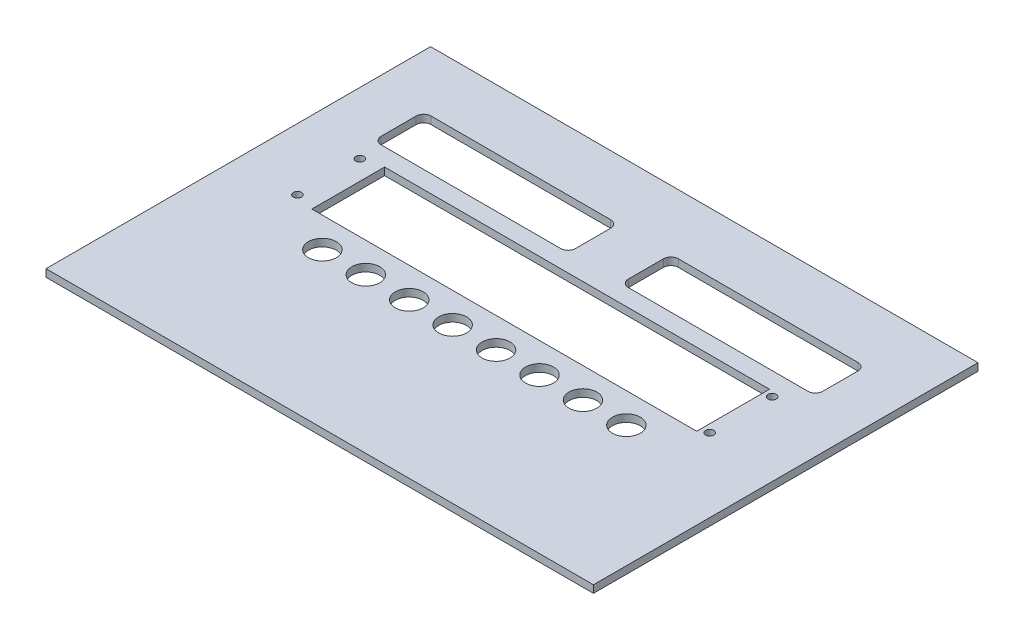
from build123d import *

# Parameters (mm, degrees)
SKETCH1_W                = 232.41
SKETCH1_H                = 163.2712
BOSS_EXTRUDE1_DEPTH      = 3.175
SKETCH2_W                = 82.55
SKETCH2_H                = 21.209
CUT_EXTRUDE1_DEPTH       = 143.049476723
FILLET1_R                = 3.175
LPATTERN1_COUNT          = 2
LPATTERN1_PITCH          = 104.9866582
FILLET1_OF_LPATTERN1_R   = 3.175
CUT_EXTRUDE4_START       = -3.175
CUT_EXTRUDE4_OUTLINE_R   = 5.92074
CUT_EXTRUDE4_OUTLINE_W   = 163.40074
CUT_EXTRUDE4_OUTLINE_H   = 30.8991
CUT_EXTRUDE4_OUTLINE_R_2 = 1.75
CUT_EXTRUDE4_DEPTH       = 3.175


# Read off the part's stored shape, not the designer's step: Cut-Extrude4
with BuildPart() as part:
    # Sketch1 → Boss-Extrude1 (new body)
    with BuildSketch(Plane(origin=(0, 0, 0), x_dir=(1, 0, 0), z_dir=(0, 1, 0))):
        Rectangle(SKETCH1_W, SKETCH1_H)
    extrude(amount=-BOSS_EXTRUDE1_DEPTH)

    # Sketch2 → Cut-Extrude1 (cut, through all)
    with BuildSketch(Plane(origin=(0, 0, 0), x_dir=(1, 0, 0), z_dir=(0, 1, 0))):
        with Locations((-52.49333418, 45.6311)):
            Rectangle(SKETCH2_W, SKETCH2_H)
    cut_extrude1 = extrude(amount=-CUT_EXTRUDE1_DEPTH, mode=Mode.SUBTRACT)

    # Fillet1
    fillet1_edges = [part.edges().sort_by_distance(p)[0] for p in [
        (-93.76833418, -1.5875, -35.0266),
        (-93.76833418, -1.5875, -56.2356),
        (-11.21833418, -1.5875, -56.2356),
        (-11.21833418, -1.5875, -35.0266),
    ]]
    fillet(fillet1_edges, radius=FILLET1_R)

    # LPattern1: Cut-Extrude1 ×2
    with Locations(*[(i * LPATTERN1_PITCH, 0, 0) for i in range(1, LPATTERN1_COUNT)]):
        add(cut_extrude1, mode=Mode.SUBTRACT)

    # Fillet1 of LPattern1
    fillet1_of_lpattern1_edges = [part.edges().sort_by_distance(p)[0] for p in [
        (11.21832402, -1.5875, -35.0266),
        (11.21832402, -1.5875, -56.2356),
        (93.76832402, -1.5875, -56.2356),
        (93.76832402, -1.5875, -35.0266),
    ]]
    fillet(fillet1_of_lpattern1_edges, radius=FILLET1_OF_LPATTERN1_R)

    # Cut-Extrude4 outline → Cut-Extrude4 (cut)
    with BuildSketch(Plane(origin=(0, 0, 0), x_dir=(1, 0, 0), z_dir=(0, 1, 0)).offset(CUT_EXTRUDE4_START)):
        with Locations((-64.529208, -15.98168)):
            Circle(CUT_EXTRUDE4_OUTLINE_R)
        with Locations((-46.091348, -15.98168)):
            Circle(CUT_EXTRUDE4_OUTLINE_R)
        with Locations((-27.653488, -15.98168)):
            Circle(CUT_EXTRUDE4_OUTLINE_R)
        with Locations((-9.215628, -15.98168)):
            Circle(CUT_EXTRUDE4_OUTLINE_R)
        with Locations((9.222232, -15.98168)):
            Circle(CUT_EXTRUDE4_OUTLINE_R)
        with Locations((27.660092, -15.98168)):
            Circle(CUT_EXTRUDE4_OUTLINE_R)
        with Locations((46.097952, -15.98168)):
            Circle(CUT_EXTRUDE4_OUTLINE_R)
        with Locations((64.535812, -15.98168)):
            Circle(CUT_EXTRUDE4_OUTLINE_R)
        with Locations((0, 12.16787)):
            Rectangle(CUT_EXTRUDE4_OUTLINE_W, CUT_EXTRUDE4_OUTLINE_H)
        with Locations((-90, 25.41778)):
            Circle(CUT_EXTRUDE4_OUTLINE_R_2)
        with Locations((-90, -1.08222)):
            Circle(CUT_EXTRUDE4_OUTLINE_R_2)
        with Locations((85, -1.08222)):
            Circle(CUT_EXTRUDE4_OUTLINE_R_2)
        with Locations((85, 25.41778)):
            Circle(CUT_EXTRUDE4_OUTLINE_R_2)
    extrude(amount=CUT_EXTRUDE4_DEPTH, mode=Mode.SUBTRACT)


solid = part.part
